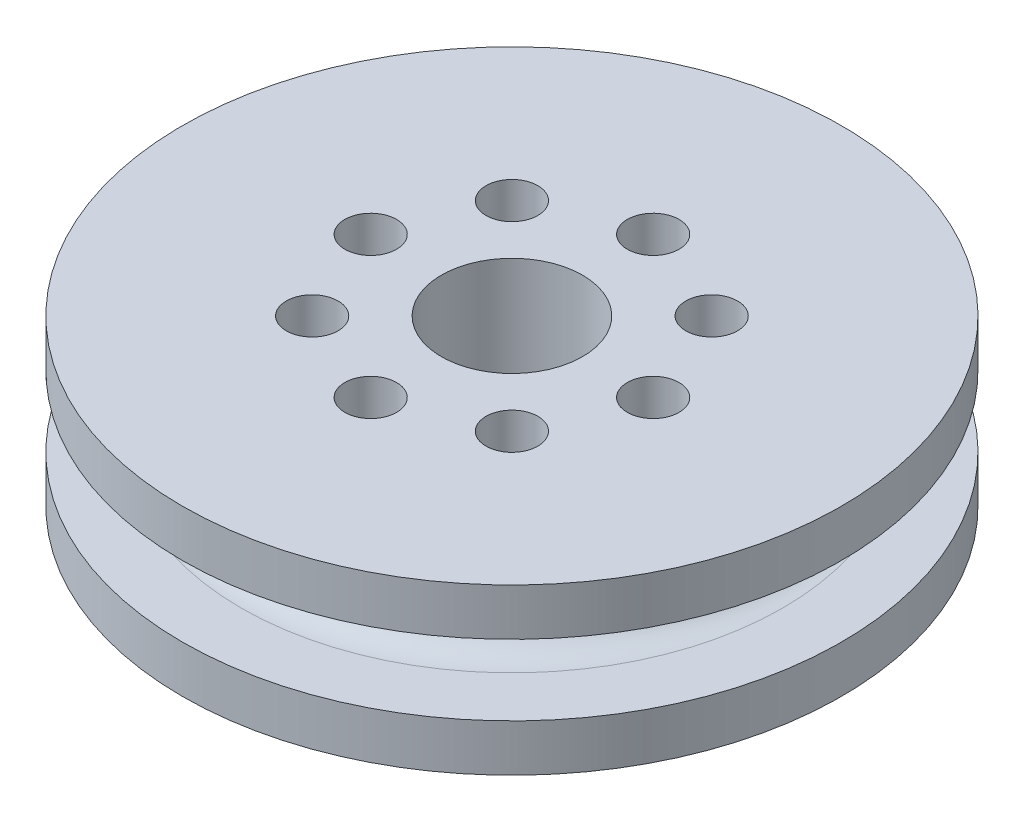
from build123d import *

# Parameters (mm, degrees)
SKETCH_2_R          = 3
SKETCH_2_R_2        = 1.1
CUT_EXTRUDE_1_DEPTH = 22


with BuildPart() as part:
    # ｽｹｯﾁ1 → 回転1 (revolve)
    with BuildSketch(Plane.XY):
        with BuildLine():
            Line((0, 3.5), (-14, 3.5))
            Line((-14, 3.5), (-14, 1.5))
            Line((-14, 1.5), (-11.5, 1.5))
            ThreePointArc((-11.5, 1.5), (-10, 0), (-11.5, -1.5))
            Line((-11.5, -1.5), (-14, -1.5))
            Line((-14, -1.5), (-14, -3.5))
            Line((-14, -3.5), (0, -3.5))
            Line((0, -3.5), (0, 3.5))
        make_face()
    revolve(axis=Axis((0, 3.5, 0), (0, -1, 0)))

    # ｽｹｯﾁ2 → ｶｯﾄ - 押し出し1 (cut, through all)
    with BuildSketch(Plane.XZ.offset(3.5)):
        Circle(SKETCH_2_R)
        with Locations((0, 6)):
            Circle(SKETCH_2_R_2)
        with Locations((4.242640687, 4.242640687)):
            Circle(SKETCH_2_R_2)
        with Locations((6, 0)):
            Circle(SKETCH_2_R_2)
        with Locations((4.242640687, -4.242640687)):
            Circle(SKETCH_2_R_2)
        with Locations((0, -6)):
            Circle(SKETCH_2_R_2)
        with Locations((-4.242640687, -4.242640687)):
            Circle(SKETCH_2_R_2)
        with Locations((-6, 0)):
            Circle(SKETCH_2_R_2)
        with Locations((-4.242640687, 4.242640687)):
            Circle(SKETCH_2_R_2)
    extrude(amount=-CUT_EXTRUDE_1_DEPTH, mode=Mode.SUBTRACT)


solid = part.part
